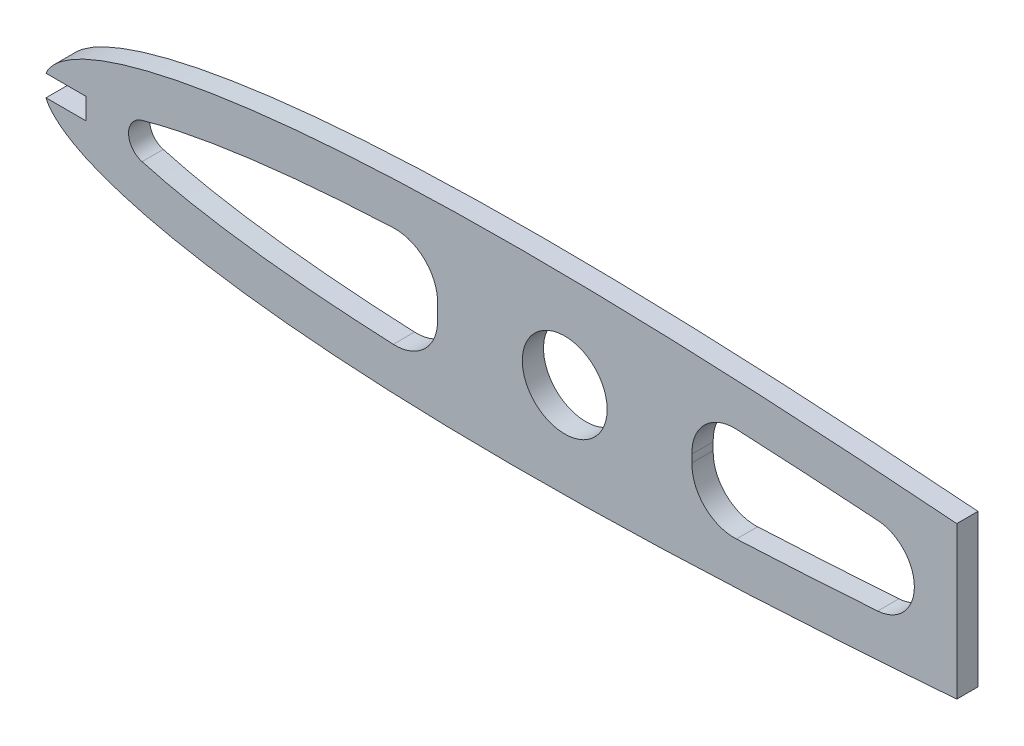
from build123d import *

# Parameters (mm, degrees)
BOSS_EXTRUDE1_DEPTH = 3.175
SKETCH3_R           = 6.35
SKETCH3_W           = 101.6
SKETCH3_H           = 101.6
SKETCH3_W_2         = 6.35
SKETCH3_H_2         = 3.175
CUT_EXTRUDE1_DEPTH  = 5.08
CUT_EXTRUDE2_DEPTH  = 5.08
FILLET1_R           = 6.35
FILLET2_DEPTH       = 3.175
FILLET3_DEPTH       = 3.175


with BuildPart() as part:
    # Sketch2 → Boss-Extrude1 (new body)
    with BuildSketch(Plane.XY):
        with BuildLine():
            add(Edge.make_bspline(
                [(238.252, 0), (238.137287952, 0.133045201), (237.77207605, 0.556624867), (236.492491596, 0.433381797), (234.746176517, 0.839991501), (232.179813549, 1.11930028), (228.961819586, 1.582109184), (225.049510149, 2.090865972), (220.490135834, 2.68626254), (215.303857957, 3.3424435), (209.525250222, 4.056068786), (203.189096271, 4.814866496), (196.334767874, 5.610240284), (189.004344512, 6.431112947), (181.243085157, 7.267536628), (173.098884015, 8.109100956), (164.621936298, 8.944949754), (155.864527368, 9.763348396), (146.880589413, 10.553553512), (137.725609535, 11.302354143), (128.455841103, 11.997541105), (119.128519532, 12.626207685), (109.801114172, 13.175209012), (100.531046651, 13.630675258), (91.37556861, 13.980460991), (82.390862495, 14.213154889), (73.632451948, 14.3173913), (65.154153809, 14.284897979), (57.008238889, 14.109398576), (49.244849388, 13.786444375), (41.91176916, 13.315190578), (35.054071993, 12.697055156), (28.713707328, 11.936865774), (22.929370487, 11.041090517), (17.735955293, 10.019084993), (13.164400922, 8.882405292), (9.239142537, 7.642135457), (5.984741248, 6.30982688), (3.398200889, 4.894493254), (1.521056143, 3.393341148), (0.248902593, 1.770054281), (0.079123223, 0.562679551), (0, 0)],
                knots=[0, 0, 0, 0, 0.002091853, 0.006659889, 0.014240034, 0.024784942, 0.038226646, 0.054481348, 0.073444809, 0.094998776, 0.11900639, 0.145318898, 0.173770288, 0.204183654, 0.236370679, 0.270129473, 0.305250351, 0.341516861, 0.378701149, 0.416575318, 0.454902219, 0.493447217, 0.531971459, 0.57023708, 0.608012632, 0.645066312, 0.681178002, 0.716129843, 0.74971807, 0.781748295, 0.812036536, 0.840415327, 0.866732056, 0.890849065, 0.912651845, 0.932046273, 0.94897292, 0.963413199, 0.975421325, 0.985175212, 0.993091122, 1, 1, 1, 1], degree=3))
            add(Edge.make_bspline(
                [(238.252, 0), (238.137287952, -0.133045201), (237.77207605, -0.556624867), (236.492491596, -0.433381797), (234.746176517, -0.839991501), (232.179813549, -1.11930028), (228.961819586, -1.582109184), (225.049510149, -2.090865972), (220.490135834, -2.68626254), (215.303857957, -3.3424435), (209.525250222, -4.056068786), (203.189096271, -4.814866496), (196.334767874, -5.610240284), (189.004344512, -6.431112947), (181.243085157, -7.267536628), (173.098884015, -8.109100956), (164.621936298, -8.944949754), (155.864527368, -9.763348396), (146.880589413, -10.553553512), (137.725609535, -11.302354143), (128.455841103, -11.997541105), (119.128519532, -12.626207685), (109.801114172, -13.175209012), (100.531046651, -13.630675258), (91.37556861, -13.980460991), (82.390862495, -14.213154889), (73.632451948, -14.3173913), (65.154153809, -14.284897979), (57.008238889, -14.109398576), (49.244849388, -13.786444375), (41.91176916, -13.315190578), (35.054071993, -12.697055156), (28.713707328, -11.936865774), (22.929370487, -11.041090517), (17.735955293, -10.019084993), (13.164400922, -8.882405292), (9.239142537, -7.642135457), (5.984741248, -6.30982688), (3.398200889, -4.894493254), (1.521056143, -3.393341148), (0.248902593, -1.770054281), (0.079123223, -0.562679551), (0, 0)],
                knots=[0, 0, 0, 0, 0.002091853, 0.006659889, 0.014240034, 0.024784942, 0.038226646, 0.054481348, 0.073444809, 0.094998776, 0.11900639, 0.145318898, 0.173770288, 0.204183654, 0.236370679, 0.270129473, 0.305250351, 0.341516861, 0.378701149, 0.416575318, 0.454902219, 0.493447217, 0.531971459, 0.57023708, 0.608012632, 0.645066312, 0.681178002, 0.716129843, 0.74971807, 0.781748295, 0.812036536, 0.840415327, 0.866732056, 0.890849065, 0.912651845, 0.932046273, 0.94897292, 0.963413199, 0.975421325, 0.985175212, 0.993091122, 1, 1, 1, 1], degree=3))
        make_face()
    extrude(amount=BOSS_EXTRUDE1_DEPTH)

    # Sketch3 → Cut-Extrude1 (cut)
    with BuildSketch(Plane.XY.offset(3.175)):
        with Locations((77.978, 0)):
            Circle(SKETCH3_R)
        with Locations((187.452, 0)):
            Rectangle(SKETCH3_W, SKETCH3_H)
        with Locations((3.175, 0)):
            Rectangle(SKETCH3_W_2, SKETCH3_H_2)
    extrude(amount=-CUT_EXTRUDE1_DEPTH, mode=Mode.SUBTRACT)

    # Sketch4 → Cut-Extrude2 (cut)
    with BuildSketch(Plane.XY.offset(3.175)):
        with BuildLine():
            Line((12.7, 2.061236545), (12.7, -2.061236545))
            add(Edge.make_bspline(
                [(12.7, -2.061236545), (13.87302955, -2.443877536), (15.059598103, -2.782274606), (17.45007242, -3.402412701), (18.654719046, -3.682875551), (22.272131196, -4.457000706), (24.694910319, -4.884570871), (29.554752497, -5.626532885), (31.991957197, -5.93980242), (36.877070752, -6.481527427), (39.324986389, -6.70992917), (46.681501726, -7.293964145), (51.604643093, -7.550220084), (57.888045432, -7.759101786), (59.249411697, -7.797222339), (60.610975339, -7.828726233)],
                knots=[0, 0, 0, 0, 0.03125, 0.03125, 0.0625, 0.0625, 0.125, 0.125, 0.1875, 0.1875, 0.25, 0.25, 0.375, 0.375, 0.409562817, 0.409562817, 0.409562817, 0.409562817], degree=3))
            ThreePointArc((60.610975339, -7.828726233), (58.928, -2.977e-06), (60.610972892, 7.828720805))
            add(Edge.make_bspline(
                [(60.610972892, 7.828720805), (59.248339009, 7.797194353), (57.886109917, 7.759046352), (51.605681243, 7.550222376), (46.692451729, 7.294644767), (39.334730429, 6.710796809), (36.884205555, 6.482297599), (31.98834866, 5.939423271), (29.540067539, 5.624629017), (24.668508937, 4.880199139), (22.245087233, 4.451720456), (18.638476615, 3.679142949), (17.440989968, 3.400141258), (15.059205889, 2.782087789), (13.874610371, 2.444393198), (12.7, 2.061236545)],
                knots=[0.590397153, 0.590397153, 0.590397153, 0.590397153, 0.625, 0.625, 0.75, 0.75, 0.8125, 0.8125, 0.875, 0.875, 0.9375, 0.9375, 0.96875, 0.96875, 1, 1, 1, 1], degree=3))
        make_face()
        with BuildLine():
            Line((130.302, -5.486095107), (130.302, 5.486095107))
            add(Edge.make_bspline(
                [(130.302, 5.486095107), (120.479608061, 6.203654851), (110.65279807, 6.808891522), (99.048125108, 7.323580363), (97.276696647, 7.396621304), (95.50503071, 7.463624756)],
                knots=[0, 0, 0, 0, 0.25, 0.25, 0.295030215, 0.295030215, 0.295030215, 0.295030215], degree=3))
            ThreePointArc((95.50503071, 7.463624756), (97.028, 8e-09), (95.505030716, -7.463624741))
            add(Edge.make_bspline(
                [(95.505030716, -7.463624741), (97.277633364, -7.3965859), (99.049998284, -7.323503172), (110.654669728, -6.808775817), (120.480543478, -6.203586515), (130.302, -5.486095107)],
                knots=[0.704941686, 0.704941686, 0.704941686, 0.704941686, 0.75, 0.75, 1, 1, 1, 1], degree=3))
        make_face()
    extrude(amount=-CUT_EXTRUDE2_DEPTH, mode=Mode.SUBTRACT)

    # Fillet1
    fillet1_edges = [part.edges().sort_by_distance(p)[0] for p in [
        (95.505030716, -7.463624741, 1.5875),
        (95.50503071, 7.463624756, 1.5875),
        (60.610975339, -7.828726233, 1.5875),
        (60.610972892, 7.828720805, 1.5875),
    ]]
    fillet(fillet1_edges, radius=FILLET1_R)

    # Fillet2: read off the stored shape, not the designer's step
    # Fillet2 outline → Fillet2 (add)
    with BuildSketch(Plane.XY):
        with BuildLine():
            add(Edge.make_bspline(
                [(12.7, -2.061236545), (13.369816068, -2.279729834), (14.044046619, -2.483797093), (14.721784869, -2.67640159)],
                knots=[0, 0, 0, 0, 0.017844181, 0.017844181, 0.017844181, 0.017844181], degree=3))
            add(Edge.make_bspline(
                [(14.721784869, -2.67640159), (13.589337149, -2.354574507), (12.699999989, -1.401222797), (12.7, 5.587e-06)],
                knots=[0, 0, 0, 0, 0.499999161, 0.499999161, 0.499999161, 0.499999161], degree=3, weights=[1, 0.757787173, 0.636680556, 0.63668015]))
            Line((12.7, 5.587e-06), (12.7, -2.061236545))
        make_face()
        with BuildLine():
            Line((12.7, 2.061236545), (12.7, 5.587e-06))
            add(Edge.make_bspline(
                [(12.7, 5.587e-06), (12.700000011, 1.401240459), (13.589344107, 2.354593836), (14.72179848, 2.676416587)],
                knots=[0.499999161, 0.499999161, 0.499999161, 0.499999161, 1, 1, 1, 1], degree=3, weights=[0.63668015, 0.636679744, 0.75778636, 1]))
            add(Edge.make_bspline(
                [(14.72179848, 2.676416587), (14.045066341, 2.484101731), (13.370904406, 2.280084849), (12.7, 2.061236545)],
                knots=[0.982150879, 0.982150879, 0.982150879, 0.982150879, 1, 1, 1, 1], degree=3))
        make_face()
    extrude(amount=FILLET2_DEPTH)

    # Fillet3: read off the stored shape, not the designer's step
    # Fillet3 outline → Fillet3 (add)
    with BuildSketch(Plane.XY):
        with BuildLine():
            add(Edge.make_bspline(
                [(130.302, 5.486095107), (128.473607675, 5.619665498), (126.645062264, 5.749343885), (124.816349362, 5.874764032)],
                knots=[0, 0, 0, 0, 0.046536331, 0.046536331, 0.046536331, 0.046536331], degree=3))
            add(Edge.make_bspline(
                [(124.816349362, 5.874764032), (127.6499069, 5.680427784), (130.302000005, 3.665691382), (130.302, 1e-08)],
                knots=[0, 0, 0, 0, 0.499999999, 0.499999999, 0.499999999, 0.499999999], degree=3, weights=[1, 0.689474367, 0.534211549, 0.534211549]))
            Line((130.302, 1e-08), (130.302, 5.486095107))
        make_face()
        with BuildLine():
            Line((130.302, -5.486095107), (130.302, 1e-08))
            add(Edge.make_bspline(
                [(130.302, 1e-08), (130.301999995, -3.665691389), (127.649906854, -5.680427785), (124.816349294, -5.874764)],
                knots=[0.499999999, 0.499999999, 0.499999999, 0.499999999, 1, 1, 1, 1], degree=3, weights=[0.534211549, 0.534211548, 0.689474365, 1]))
            add(Edge.make_bspline(
                [(124.816349294, -5.874764), (126.645062219, -5.749343873), (128.473607653, -5.619665499), (130.302, -5.486095107)],
                knots=[0.953459236, 0.953459236, 0.953459236, 0.953459236, 1, 1, 1, 1], degree=3))
        make_face()
    extrude(amount=FILLET3_DEPTH)


solid = part.part
